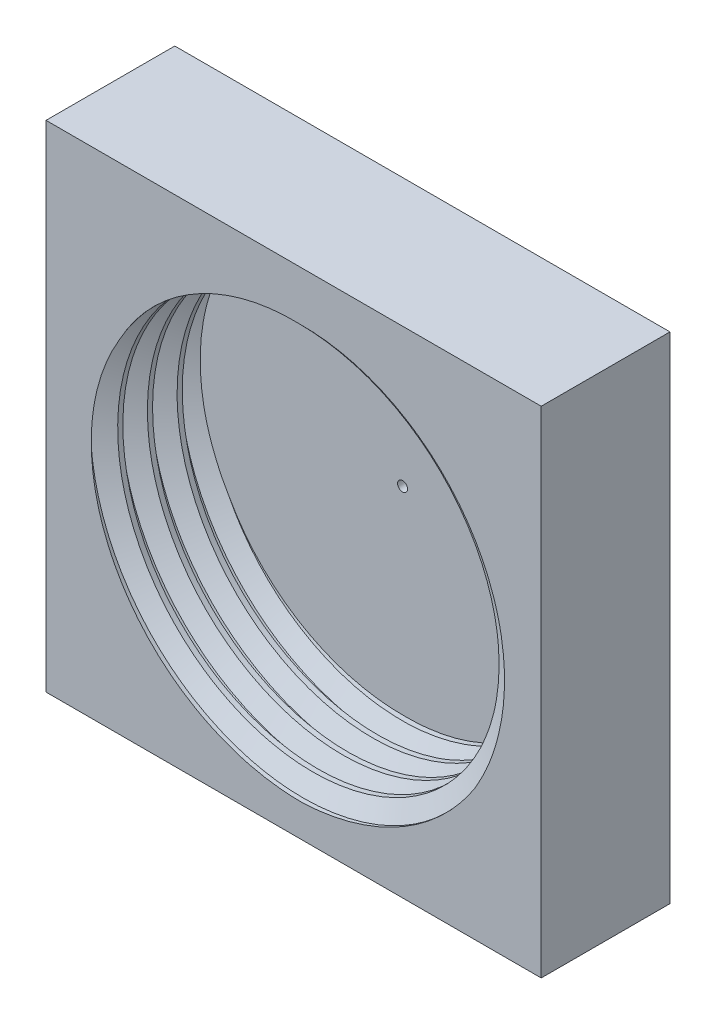
from build123d import *

# Parameters (mm, degrees)
SKETCH1_W           = 50
SKETCH1_H           = 50
SKETCH1_R           = 20
BOSS_EXTRUDE1_DEPTH = 11
SKETCH2_W           = 50
SKETCH2_H           = 50
BOSS_EXTRUDE2_DEPTH = 2
SKETCH11_R          = 0.5
CUT_EXTRUDE3_DEPTH  = 38.027017163
CUT_SWEEP1_PITCH    = 3
CUT_SWEEP1_TO       = 11


with BuildPart() as part:
    # Sketch1 → Boss-Extrude1 (new body)
    with BuildSketch(Plane.XY):
        Rectangle(SKETCH1_W, SKETCH1_H)
        Circle(SKETCH1_R, mode=Mode.SUBTRACT)
    extrude(amount=BOSS_EXTRUDE1_DEPTH)

    # Sketch2 → Boss-Extrude2 (add)
    with BuildSketch(Plane.XY):
        Rectangle(SKETCH2_W, SKETCH2_H)
    extrude(amount=-BOSS_EXTRUDE2_DEPTH)

    # Sketch11 → Cut-Extrude3 (cut, through all)
    with BuildSketch(Plane.XY):
        Circle(SKETCH11_R)
    extrude(amount=-CUT_EXTRUDE3_DEPTH, mode=Mode.SUBTRACT)

    # Cut-Sweep1: arcs per turn and ends read off the stored shape
    # Cut-Sweep1: the profile of Sketch14 screwed along a right-hand helix through 5.6 turns, 10 arcs to a turn; built about Z, then put on its axis
    cut_sweep1_z = Axis((0, 0, 0), (0, 0, 1))
    cut_sweep1_corners = [(19.999377909, 0, -2.760258141), (19.999377909, 0, -5.23998362), (21.749377909, 0, -4.229620649), (21.749377909, 0, -3.770621112)]
    with BuildLine(mode=Mode.PRIVATE) as cut_sweep1_profile:
        Line(cut_sweep1_corners[0], cut_sweep1_corners[1])
        Line(cut_sweep1_corners[1], cut_sweep1_corners[2])
        Line(cut_sweep1_corners[2], cut_sweep1_corners[3])
        Line(cut_sweep1_corners[3], cut_sweep1_corners[0])
    cut_sweep1_cap = Face(cut_sweep1_profile.wire())
    cut_sweep1_turn_angles = [0, 18, 36, 54, 72, 90, 108, 126, 144, 162, 180, 198, 216, 234, 252, 270, 288, 306, 324, 342, 360]
    cut_sweep1_turn_weights = [1, 0.9510565162951535, 1, 0.9510565162951535, 1, 0.9510565162951535, 1, 0.9510565162951535, 1, 0.9510565162951535, 1, 0.9510565162951535, 1, 0.9510565162951535, 1, 0.9510565162951535, 1, 0.9510565162951535, 1, 0.9510565162951535, 1]
    cut_sweep1_turn_rails = [Edge.make_bspline([Vector(p[0], p[1], 0).rotate(cut_sweep1_z, cut_sweep1_turn_angles[k]) / cut_sweep1_turn_weights[k] + Vector(0, 0, p[2] + CUT_SWEEP1_PITCH * cut_sweep1_turn_angles[k] / 360) for k in range(21)], [0, 0, 0, 1, 1, 2, 2, 3, 3, 4, 4, 5, 5, 6, 6, 7, 7, 8, 8, 9, 9, 10, 10, 10], 2, cut_sweep1_turn_weights) for p in cut_sweep1_corners]
    cut_sweep1_turn_sides = [Face.make_surface_from_curves(cut_sweep1_turn_rails[p[0]], cut_sweep1_turn_rails[p[1]]) for p in [(0, 1), (1, 2), (2, 3), (3, 0)]]
    cut_sweep1_last_angles = [1800, 1818, 1836, 1854, 1872, 1890, 1908, 1926, 1944, 1962, 1980, 1998, 2016]
    cut_sweep1_last_weights = [1, 0.9510565162951535, 1, 0.9510565162951535, 1, 0.9510565162951535, 1, 0.9510565162951535, 1, 0.9510565162951535, 1, 0.9510565162951535, 1]
    cut_sweep1_last_rails = [Edge.make_bspline([Vector(p[0], p[1], 0).rotate(cut_sweep1_z, cut_sweep1_last_angles[k]) / cut_sweep1_last_weights[k] + Vector(0, 0, p[2] + CUT_SWEEP1_PITCH * cut_sweep1_last_angles[k] / 360) for k in range(13)], [0, 0, 0, 1, 1, 2, 2, 3, 3, 4, 4, 5, 5, 6, 6, 6], 2, cut_sweep1_last_weights) for p in cut_sweep1_corners]
    cut_sweep1_last_sides = [Face.make_surface_from_curves(cut_sweep1_last_rails[p[0]], cut_sweep1_last_rails[p[1]]) for p in [(0, 1), (1, 2), (2, 3), (3, 0)]]
    cut_sweep1 = Plane(origin=(0, 0, 11), x_dir=(0.499999999999998, 0.8660254037844398, 0), z_dir=(0, 0, -1)) * split(Solid(Shell([*[p.moved(Location((0, 0, CUT_SWEEP1_PITCH * i))) for i in range(5) for p in cut_sweep1_turn_sides], *cut_sweep1_last_sides, cut_sweep1_cap, cut_sweep1_cap.rotate(cut_sweep1_z, 2016).moved(Location((0, 0, CUT_SWEEP1_PITCH * 2016 / 360)))])), bisect_by=Plane.XY.offset(CUT_SWEEP1_TO), keep=Keep.BOTTOM, mode=Mode.PRIVATE)
    add(cut_sweep1, mode=Mode.SUBTRACT)


solid = part.part
